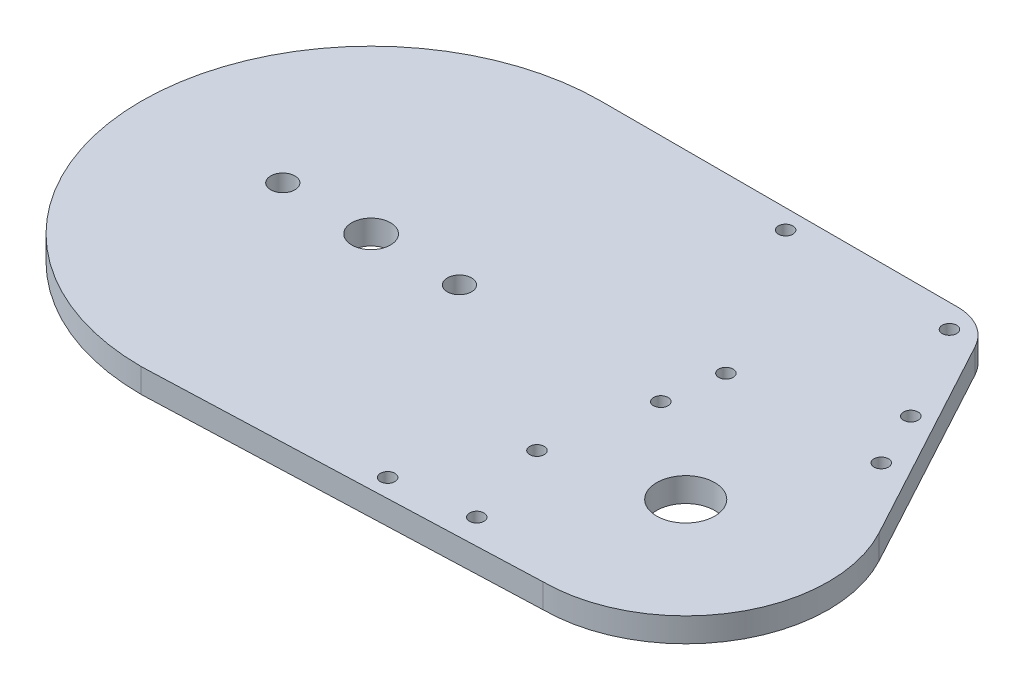
from build123d import *

# Parameters (mm, degrees)
SKETCH1_R           = 4
SKETCH1_R_2         = 1.5
SKETCH1_R_3         = 2.5
SKETCH1_R_4         = 6
BOSS_EXTRUDE1_DEPTH = 5


with BuildPart() as part:
    # Sketch1 → Boss-Extrude1 (new body)
    with BuildSketch(Plane(origin=(0, 0, 0), x_dir=(1, 0, 0), z_dir=(0, 1, 0))):
        with BuildLine():
            Line((0, -47.5), (80, -44.5))
            ThreePointArc((80, -44.5), (105.341650726, -30.101348895), (105.945295539, -0.961067014))
            Line((105.945295539, -0.961067014), (82.559049402, 42.258960334))
            ThreePointArc((82.559049402, 42.258960334), (78.883135286, 46.090390077), (73.764033965, 47.5))
            Line((73.764033965, 47.5), (0, 47.5))
            ThreePointArc((0, 47.5), (-47.5, 0), (0, -47.5))
        make_face()
        Circle(SKETCH1_R, mode=Mode.SUBTRACT)
        with Locations((59.934677664, -0.087493854)):
            Circle(SKETCH1_R_2, mode=Mode.SUBTRACT)
        with Locations((18.25, 0)):
            Circle(SKETCH1_R_3, mode=Mode.SUBTRACT)
        with Locations((-18.25, 0)):
            Circle(SKETCH1_R_3, mode=Mode.SUBTRACT)
        with Locations((80, -15)):
            Circle(SKETCH1_R_4, mode=Mode.SUBTRACT)
        with Locations((76.835494757, 42.654234046)):
            Circle(SKETCH1_R_2, mode=Mode.SUBTRACT)
        with Locations((88.354686129, 23.142870245)):
            Circle(SKETCH1_R_2, mode=Mode.SUBTRACT)
        with Locations((42.137334928, 43.5)):
            Circle(SKETCH1_R_2, mode=Mode.SUBTRACT)
        with Locations((45.293422434, -41.885064382)):
            Circle(SKETCH1_R_2, mode=Mode.SUBTRACT)
        with Locations((61.591696316, 11.71100727)):
            Circle(SKETCH1_R_2, mode=Mode.SUBTRACT)
        with Locations((93.688017257, 11.71100727)):
            Circle(SKETCH1_R_2, mode=Mode.SUBTRACT)
        with Locations((61.591696316, -39.768646015)):
            Circle(SKETCH1_R_2, mode=Mode.SUBTRACT)
        with Locations((55.895338842, -21.630634241)):
            Circle(SKETCH1_R_2, mode=Mode.SUBTRACT)
    extrude(amount=BOSS_EXTRUDE1_DEPTH)


solid = part.part
